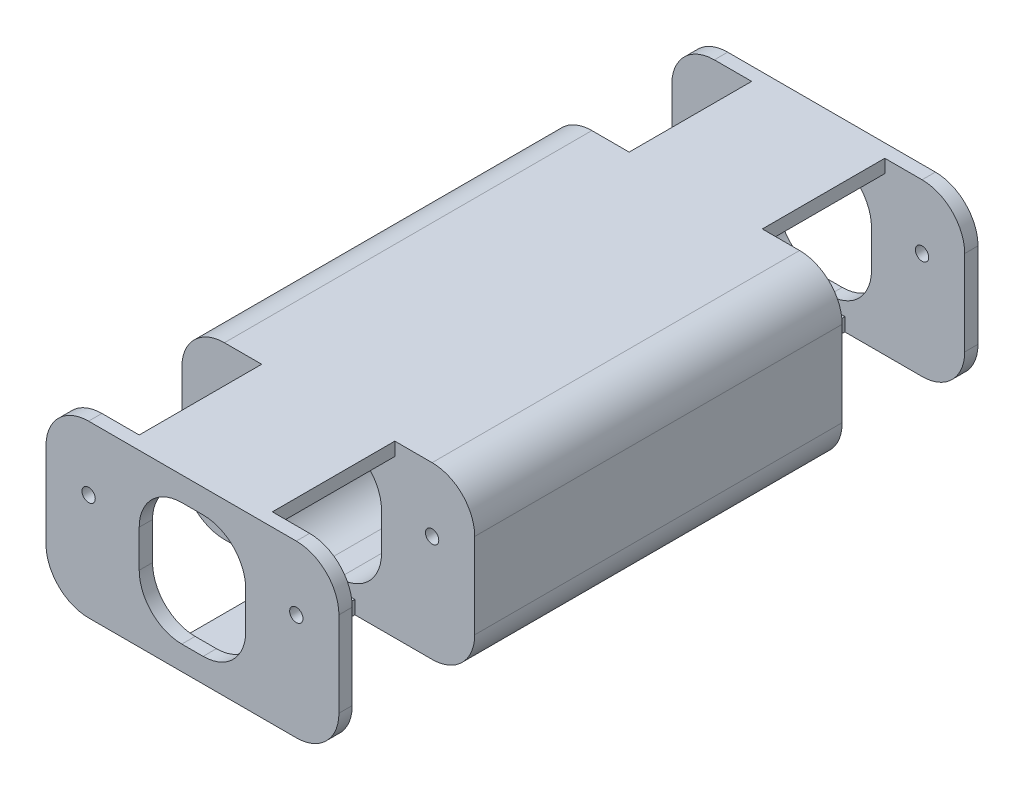
from build123d import *

# Parameters (mm, degrees)
SKETCH1_W             = 110
SKETCH1_H             = 64
SKETCH1_R             = 2.5
SKETCH1_W_2           = 40
SKETCH1_H_2           = 46
BOSS_EXTRUDE1_DEPTH   = 5
FILLET1_R             = 16
FILLET2_R             = 16
SKETCH2_W             = 50
SKETCH2_H             = 5
SKETCH2_W_2           = 20
BOSS_EXTRUDE2_DEPTH   = 46
BOSS_EXTRUDE3_START   = 51
SKETCH1_2_W           = 110
SKETCH1_2_H           = 64
SKETCH1_2_R           = 2.5
SKETCH1_2_W_2         = 40
SKETCH1_2_H_2         = 46
BOSS_EXTRUDE3_DEPTH   = 69
FILLET3_R             = 16
MIRROR2_START         = 120
MIRROR2_OUTLINE_R     = 2.5
MIRROR2_DEPTH         = 69
MIRROR2_START_2       = 235
MIRROR2_2_OUTLINE_R   = 2.5
MIRROR2_2_DEPTH       = 5
MIRROR2_START_3       = 189
MIRROR2_3_OUTLINE_W   = 20
MIRROR2_3_OUTLINE_H   = 5
MIRROR2_3_OUTLINE_W_2 = 50
MIRROR2_3_DEPTH       = 46


# Read off the part's stored shape, not the designer's step: Mirror2
with BuildPart() as part:
    # Sketch1 → Boss-Extrude1 (new body)
    with BuildSketch(Plane.XY):
        Rectangle(SKETCH1_W, SKETCH1_H)
        with Locations((39, 8)):
            Circle(SKETCH1_R, mode=Mode.SUBTRACT)
        with Locations((-39, 8)):
            Circle(SKETCH1_R, mode=Mode.SUBTRACT)
        Rectangle(SKETCH1_W_2, SKETCH1_H_2, mode=Mode.SUBTRACT)
    extrude(amount=BOSS_EXTRUDE1_DEPTH)

    # Fillet1
    fillet1_edges = [part.edges().sort_by_distance(p)[0] for p in [
        (55, -32, 2.5),
        (-55, -32, 2.5),
        (-55, 32, 2.5),
        (55, 32, 2.5),
    ]]
    fillet(fillet1_edges, radius=FILLET1_R)

    # Fillet2
    fillet2_edges = [part.edges().sort_by_distance(p)[0] for p in [
        (20, -23, 2.5),
        (20, 23, 2.5),
        (-20, 23, 2.5),
        (-20, -23, 2.5),
    ]]
    fillet(fillet2_edges, radius=FILLET2_R)

    # Sketch2 → Boss-Extrude2 (add)
    with BuildSketch(Plane.XY.offset(5)):
        with Locations((0, 29.5)):
            Rectangle(SKETCH2_W, SKETCH2_H)
        with Locations((0, -29.5)):
            Rectangle(SKETCH2_W_2, SKETCH2_H)
    extrude(amount=BOSS_EXTRUDE2_DEPTH)

    # Sketch1<2> → Boss-Extrude3 (add)
    with BuildSketch(Plane.XY.offset(BOSS_EXTRUDE3_START)):
        Rectangle(SKETCH1_2_W, SKETCH1_2_H)
        with Locations((39, 8)):
            Circle(SKETCH1_2_R, mode=Mode.SUBTRACT)
        with Locations((-39, 8)):
            Circle(SKETCH1_2_R, mode=Mode.SUBTRACT)
        Rectangle(SKETCH1_2_W_2, SKETCH1_2_H_2, mode=Mode.SUBTRACT)
    extrude(amount=BOSS_EXTRUDE3_DEPTH)

    # Fillet3
    fillet3_edges = [part.edges().sort_by_distance(p)[0] for p in [
        (55, 32, 85.5),
        (-55, 32, 85.5),
        (-55, -32, 85.5),
        (55, -32, 85.5),
        (-20, -23, 85.5),
        (20, -23, 85.5),
        (20, 23, 85.5),
        (-20, 23, 85.5),
    ]]
    fillet(fillet3_edges, radius=FILLET3_R)

    # Mirror2 outline → Mirror2 (add)
    with BuildSketch(Plane.XY.offset(MIRROR2_START)):
        with BuildLine():
            ThreePointArc((39, -32), (50.313708499, -27.313708499), (55, -16))
            Line((55, -16), (55, 16))
            ThreePointArc((55, 16), (50.313708499, 27.313708499), (39, 32))
            Line((39, 32), (-39, 32))
            ThreePointArc((-39, 32), (-50.313708499, 27.313708499), (-55, 16))
            Line((-55, 16), (-55, -16))
            ThreePointArc((-55, -16), (-50.313708499, -27.313708499), (-39, -32))
            Line((-39, -32), (39, -32))
        make_face()
        with Locations((-39, 8)):
            Circle(MIRROR2_OUTLINE_R, mode=Mode.SUBTRACT)
        with BuildLine():
            Line((20, 7), (20, -7))
            ThreePointArc((20, -7), (15.313708499, -18.313708499), (4, -23))
            Line((4, -23), (-4, -23))
            ThreePointArc((-4, -23), (-15.313708499, -18.313708499), (-20, -7))
            Line((-20, -7), (-20, 7))
            ThreePointArc((-20, 7), (-15.313708499, 18.313708499), (-4, 23))
            Line((-4, 23), (4, 23))
            ThreePointArc((4, 23), (15.313708499, 18.313708499), (20, 7))
        make_face(mode=Mode.SUBTRACT)
        with Locations((39, 8)):
            Circle(MIRROR2_OUTLINE_R, mode=Mode.SUBTRACT)
    extrude(amount=MIRROR2_DEPTH)



with BuildPart() as body_2:
    # Mirror2 2 outline → Mirror2 2 (new body)
    with BuildSketch(Plane.XY.offset(MIRROR2_START_2)):
        with BuildLine():
            ThreePointArc((39, -32), (50.313708499, -27.313708499), (55, -16))
            Line((55, -16), (55, 16))
            ThreePointArc((55, 16), (50.313708499, 27.313708499), (39, 32))
            Line((39, 32), (-39, 32))
            ThreePointArc((-39, 32), (-50.313708499, 27.313708499), (-55, 16))
            Line((-55, 16), (-55, -16))
            ThreePointArc((-55, -16), (-50.313708499, -27.313708499), (-39, -32))
            Line((-39, -32), (39, -32))
        make_face()
        with Locations((-39, 8)):
            Circle(MIRROR2_2_OUTLINE_R, mode=Mode.SUBTRACT)
        with BuildLine():
            Line((20, 7), (20, -7))
            ThreePointArc((20, -7), (15.313708499, -18.313708499), (4, -23))
            Line((4, -23), (-4, -23))
            ThreePointArc((-4, -23), (-15.313708499, -18.313708499), (-20, -7))
            Line((-20, -7), (-20, 7))
            ThreePointArc((-20, 7), (-15.313708499, 18.313708499), (-4, 23))
            Line((-4, 23), (4, 23))
            ThreePointArc((4, 23), (15.313708499, 18.313708499), (20, 7))
        make_face(mode=Mode.SUBTRACT)
        with Locations((39, 8)):
            Circle(MIRROR2_2_OUTLINE_R, mode=Mode.SUBTRACT)
    extrude(amount=MIRROR2_2_DEPTH)


with BuildPart() as part_1:
    add(part.part)

    add(body_2.part)  # Mirror2 3 merges body 2
    # Mirror2 3 outline → Mirror2 3 (add)
    with BuildSketch(Plane.XY.offset(MIRROR2_START_3)):
        with Locations((0, -29.5)):
            Rectangle(MIRROR2_3_OUTLINE_W, MIRROR2_3_OUTLINE_H)
        with Locations((0, 29.5)):
            Rectangle(MIRROR2_3_OUTLINE_W_2, MIRROR2_3_OUTLINE_H)
    extrude(amount=MIRROR2_3_DEPTH)


solid = part_1.part
